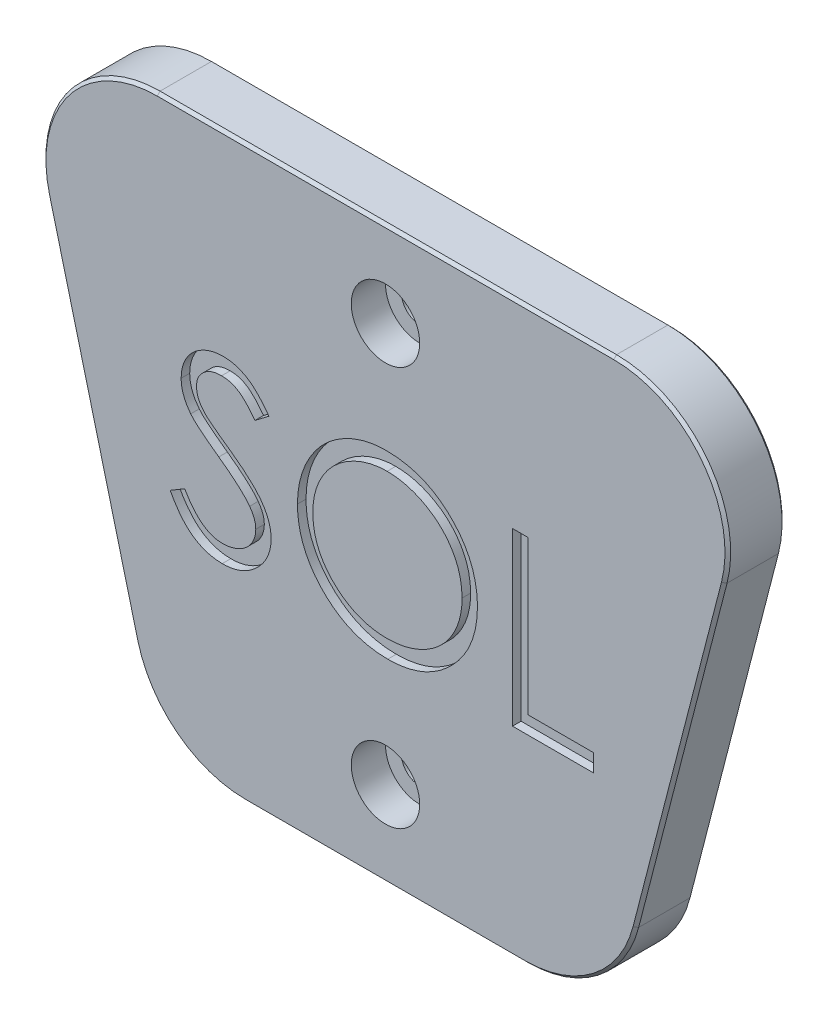
from build123d import *

# Parameters (mm, degrees)
BOSS_EXTRUDE1_DEPTH = 10
FILLET2_R           = 20
SKETCH10_R          = 6
CUT_EXTRUDE6_DEPTH  = 6
SKETCH11_R          = 3.2
CUT_EXTRUDE7_DEPTH  = 145.346804606
CUT_EXTRUDE8_DEPTH  = 1.5
CHAMFER1_SIZE       = 0.5


with BuildPart() as part:
    # Sketch2 → Boss-Extrude1 (new body)
    with BuildSketch(Plane.XY):
        with BuildLine():
            Line((0.635083269, -5), (20, -80))
            Line((20, -80), (100, -80))
            Line((100, -80), (119.364916731, -5))
            ThreePointArc((119.364916731, -5), (115.811388301, 12.247448714), (100, 20))
            Line((100, 20), (20, 20))
            ThreePointArc((20, 20), (4.188611699, 12.247448714), (0.635083269, -5))
        make_face()
    extrude(amount=BOSS_EXTRUDE1_DEPTH)

    # Fillet2
    fillet2_edges = [part.edges().sort_by_distance(p)[0] for p in [
        (20, -80, 5),
        (100, -80, 5),
    ]]
    fillet(fillet2_edges, radius=FILLET2_R)

    # Sketch10 → Cut-Extrude6 (cut)
    with BuildSketch(Plane.XY.offset(10)):
        with Locations((60, -65)):
            Circle(SKETCH10_R)
        with Locations((60, 5)):
            Circle(SKETCH10_R)
    extrude(amount=-CUT_EXTRUDE6_DEPTH, mode=Mode.SUBTRACT)

    # Sketch11 → Cut-Extrude7 (cut, through all)
    with BuildSketch(Plane.XY.offset(4)):
        with Locations((60, 5)):
            Circle(SKETCH11_R)
        with Locations((60, -65)):
            Circle(SKETCH11_R)
    extrude(amount=-CUT_EXTRUDE7_DEPTH, mode=Mode.SUBTRACT)

    # Sketch13 → Cut-Extrude8 (cut)
    # profile 1 of 3: a face of its own
    with BuildSketch(Plane.XY.offset(10)):
        with BuildLine():
            Line((22.269230769, -39.212740385), (24.805288462, -37.692307692))
            add(Edge.make_bspline(
                [(24.805288462, -37.692307692), (25.041159067, -38.087145278), (25.493078043, -38.843638854), (26.246946836, -39.865850629), (27.028086075, -40.734669116), (27.842280362, -41.445040037), (28.684559918, -42.004316209), (29.560423235, -42.400335338), (30.466918756, -42.647329413), (31.083837226, -42.677330155), (31.391826923, -42.692307692)],
                knots=[0, 0, 0, 0, 1.272034388, 2.437168799, 3.508375237, 4.49857839, 5.41946034, 6.295179144, 7.148887113, 8, 8, 8, 8], degree=3))
            add(Edge.make_bspline(
                [(31.391826923, -42.692307692), (31.654857156, -42.684981928), (32.176315211, -42.670458583), (32.943991579, -42.530908851), (33.689549884, -42.316519175), (34.397623922, -42.009482619), (35.058443475, -41.638009884), (35.637929435, -41.189328362), (36.138896119, -40.686989456), (36.54868853, -40.126566702), (36.863088832, -39.523848286), (37.104735133, -38.905197274), (37.238835764, -38.26089526), (37.259036508, -37.827091293), (37.269230769, -37.608173077)],
                knots=[0, 0, 0, 0, 1.095163259, 2.171163733, 3.241058638, 4.321873601, 5.38011039, 6.391990106, 7.366004449, 8.327778327, 9.272591725, 10.192022065, 11.087607919, 12, 12, 12, 12], degree=3))
            add(Edge.make_bspline(
                [(37.269230769, -37.608173077), (37.25659382, -37.358394365), (37.23090475, -36.850630744), (37.013777778, -36.101490861), (36.672212805, -35.360125975), (36.35710443, -34.901543699), (36.193509615, -34.663461538)],
                knots=[0, 0, 0, 0, 0.938893495, 1.908633276, 2.914225137, 4, 4, 4, 4], degree=3))
            add(Edge.make_bspline(
                [(36.193509615, -34.663461538), (36.059190065, -34.491631622), (35.777202971, -34.130896206), (35.292424292, -33.593937044), (34.723571884, -33.040064882), (34.090112842, -32.448130108), (33.36897208, -31.845663279), (32.582736242, -31.203935183), (31.711331737, -30.547350237), (31.100193194, -30.10701396), (30.784855769, -29.879807692)],
                knots=[0, 0, 0, 0, 0.722233717, 1.516239348, 2.393582979, 3.351407094, 4.387010283, 5.505090956, 6.712668013, 8, 8, 8, 8], degree=3))
            add(Edge.make_bspline(
                [(30.784855769, -29.879807692), (30.469221516, -29.654991227), (29.86575286, -29.225159265), (29.021822154, -28.58723683), (28.267155328, -28.004003663), (27.605106615, -27.469969274), (27.035967214, -26.985061233), (26.555252262, -26.55393604), (26.175207487, -26.16493409), (25.963873938, -25.912579732), (25.868990385, -25.799278846)],
                knots=[0, 0, 0, 0, 1.452282411, 2.77665338, 3.964542531, 5.026858415, 5.96415736, 6.766646006, 7.446254459, 8, 8, 8, 8], degree=3))
            add(Edge.make_bspline(
                [(25.868990385, -25.799278846), (25.736368568, -25.62269853), (25.475549968, -25.275429641), (25.131269921, -24.732645146), (24.838648526, -24.177017156), (24.609257107, -23.607052603), (24.416089517, -23.030753213), (24.286164397, -22.440599678), (24.204809566, -21.839240091), (24.196478253, -21.434552943), (24.192307692, -21.231971154)],
                knots=[0, 0, 0, 0, 1.068054152, 2.10047183, 3.106115577, 4.101338837, 5.06977816, 6.043150881, 7.020423561, 8, 8, 8, 8], degree=3))
            add(Edge.make_bspline(
                [(24.192307692, -21.231971154), (24.203495198, -20.914573086), (24.225631084, -20.286561111), (24.412835518, -19.369153993), (24.708317464, -18.493270417), (25.122273645, -17.667581842), (25.655908099, -16.91358772), (26.273445022, -16.222614975), (27.008972047, -15.641741413), (27.815994532, -15.134209484), (28.699334864, -14.736958696), (29.624971179, -14.437293152), (30.594374653, -14.267499515), (31.25097295, -14.243132958), (31.584134615, -14.230769231)],
                knots=[0, 0, 0, 0, 1.005424448, 1.989358655, 2.955360095, 3.929531133, 4.905563448, 5.876582895, 6.856512386, 7.866279853, 8.892233794, 9.918561126, 10.94386622, 12, 12, 12, 12], degree=3))
            add(Edge.make_bspline(
                [(31.584134615, -14.230769231), (31.937655475, -14.24296253), (32.640695633, -14.267211111), (33.674831766, -14.478047094), (34.67049505, -14.826909995), (35.47143732, -15.222812777), (36.098289561, -15.618224912), (36.576341555, -15.978394835), (37.060776848, -16.393038623), (37.555503032, -16.863260732), (38.052137256, -17.393375741), (38.558052561, -17.979753075), (39.074432008, -18.618809268), (39.406625094, -19.075019274), (39.576923077, -19.308894231)],
                knots=[0, 0, 0, 0, 1.286793592, 2.559021753, 3.825965368, 5.121522368, 5.803751409, 6.523245864, 7.299691795, 8.125521123, 9.008227632, 9.944561021, 10.946284179, 12, 12, 12, 12], degree=3))
            Line((39.576923077, -19.308894231), (37.143028846, -21.153846154))
            add(Edge.make_bspline(
                [(37.143028846, -21.153846154), (36.996063711, -20.964514522), (36.713043221, -20.599906065), (36.283361906, -20.089294789), (35.878373495, -19.622867821), (35.479370068, -19.217738153), (35.107424656, -18.851719867), (34.746421436, -18.538350523), (34.401555568, -18.274559705), (33.966839192, -17.993043476), (33.42068732, -17.713987732), (32.735105581, -17.477852777), (32.018651795, -17.335952246), (31.530683525, -17.317190353), (31.283653846, -17.307692308)],
                knots=[0, 0, 0, 0, 1.181633172, 2.275549214, 3.290209073, 4.226197932, 5.078386478, 5.862611352, 6.581680152, 7.217281963, 8.414376989, 9.595101626, 10.782541182, 12, 12, 12, 12], degree=3))
            add(Edge.make_bspline(
                [(31.283653846, -17.307692308), (30.973740797, -17.318078307), (30.376102676, -17.338106729), (29.527614938, -17.55684946), (28.763952723, -17.901265406), (28.10778788, -18.383965218), (27.561470934, -18.955859441), (27.166281287, -19.613963913), (26.928422734, -20.340670221), (26.89939748, -20.847598704), (26.884615385, -21.105769231)],
                knots=[0, 0, 0, 0, 1.14458467, 2.207223713, 3.21896685, 4.227309161, 5.202851033, 6.127160689, 7.046193047, 8, 8, 8, 8], degree=3))
            add(Edge.make_bspline(
                [(26.884615385, -21.105769231), (26.887985041, -21.26649619), (26.894729865, -21.588212928), (26.98879956, -22.06351083), (27.109650951, -22.537608025), (27.301159223, -23.008373021), (27.56554754, -23.484038956), (27.912734762, -23.972796706), (28.349991722, -24.478954209), (28.684937542, -24.80816027), (28.861778846, -24.981971154)],
                knots=[0, 0, 0, 0, 0.858281714, 1.717966888, 2.583508476, 3.4729293, 4.427298488, 5.488583878, 6.674047936, 8, 8, 8, 8], degree=3))
            add(Edge.make_bspline(
                [(28.861778846, -24.981971154), (28.927447753, -25.040574232), (29.083462042, -25.179801732), (29.368684263, -25.407735566), (29.745336819, -25.688902186), (30.203584258, -26.03679347), (30.75187593, -26.44034886), (31.390272125, -26.894408392), (32.111656692, -27.413712327), (32.623558829, -27.776776961), (32.894230769, -27.96875)],
                knots=[0, 0, 0, 0, 0.420754252, 0.999615792, 1.744751191, 2.668019286, 3.750313428, 4.999500688, 6.413464383, 8, 8, 8, 8], degree=3))
            add(Edge.make_bspline(
                [(32.894230769, -27.96875), (33.219824312, -28.205675939), (33.850291081, -28.664450183), (34.747356051, -29.35372744), (35.560731549, -30.027851171), (36.293273294, -30.682516374), (36.952218224, -31.312757171), (37.53025583, -31.92615586), (38.033275947, -32.518317912), (38.574812105, -33.277511417), (39.128164844, -34.209920711), (39.603377765, -35.352305613), (39.903020743, -36.499131217), (39.942205161, -37.269932673), (39.961538462, -37.650240385)],
                knots=[0, 0, 0, 0, 1.163667725, 2.253281268, 3.268753668, 4.215851969, 5.092017293, 5.902905408, 6.650798638, 7.335211899, 8.59617414, 9.77448103, 10.901945474, 12, 12, 12, 12], degree=3))
            add(Edge.make_bspline(
                [(39.961538462, -37.650240385), (39.955905849, -37.9191978), (39.944750006, -38.451889659), (39.816513602, -39.234076032), (39.628630758, -39.993769201), (39.345454467, -40.721578736), (38.999827396, -41.430819559), (38.561259557, -42.102887277), (38.052907973, -42.752656407), (37.469761417, -43.362800619), (36.831653683, -43.92291087), (36.157222014, -44.421159969), (35.445362532, -44.836602741), (34.699936961, -45.175609958), (33.920774074, -45.440754394), (33.108135927, -45.632864701), (32.260682974, -45.750770795), (31.684678846, -45.76300875), (31.391826923, -45.769230769)],
                knots=[0, 0, 0, 0, 0.983748083, 1.948392443, 2.894712957, 3.844097841, 4.80183111, 5.778335162, 6.776009319, 7.81870978, 8.863265674, 9.881300176, 10.883814829, 11.87499822, 12.874611388, 13.892143829, 14.928324115, 16, 16, 16, 16], degree=3))
            add(Edge.make_bspline(
                [(31.391826923, -45.769230769), (31.165238269, -45.764849213), (30.714914611, -45.756141281), (30.048833338, -45.679158877), (29.396208288, -45.570240846), (28.765228728, -45.397320247), (28.147765199, -45.187517586), (27.546503189, -44.929189021), (26.961151299, -44.619613009), (26.38842916, -44.265655655), (25.829793378, -43.85373213), (25.290483653, -43.373959303), (24.75280492, -42.83956926), (24.232627237, -42.236050146), (23.719428857, -41.573152293), (23.223328204, -40.844673578), (22.734056338, -40.054581974), (22.427066614, -39.498595525), (22.269230769, -39.212740385)],
                knots=[0, 0, 0, 0, 0.915332311, 1.819136955, 2.706846663, 3.586547465, 4.459518054, 5.340707479, 6.227863349, 7.133153174, 8.059268498, 9.028702269, 10.047606654, 11.120612155, 12.245963614, 13.433783089, 14.680604001, 16, 16, 16, 16], degree=3))
        make_face()
    # profile 2 of 3: a face of its own
    with BuildSketch(Plane.XY.offset(10)):
        with BuildLine():
            add(Edge.make_bspline(
                [(60.153846154, -14.230769231), (60.709344204, -14.244839054), (61.800388207, -14.272473347), (63.40388733, -14.484008521), (64.934702433, -14.849969006), (66.405303622, -15.337365999), (67.798100565, -15.987546445), (69.123576786, -16.773419145), (70.378578562, -17.703217363), (71.546190403, -18.769753593), (72.614678548, -19.930183198), (73.556043288, -21.168565284), (74.344977234, -22.477412161), (74.99285541, -23.85279071), (75.501129207, -25.291590435), (75.851863867, -26.801481887), (76.075905154, -28.372682088), (76.102097532, -29.444340928), (76.115384615, -29.987980769)],
                knots=[0, 0, 0, 0, 1.065120563, 2.091984664, 3.0946048, 4.079830382, 5.057816894, 6.036188127, 7.030412546, 8.04752943, 9.064399622, 10.05169764, 11.02544977, 11.989514704, 12.962713494, 13.945757189, 14.957906945, 16, 16, 16, 16], degree=3))
            add(Edge.make_bspline(
                [(76.115384615, -29.987980769), (76.102099479, -30.527616024), (76.075912937, -31.591299627), (75.85160913, -33.152529149), (75.49982913, -34.653306547), (74.99757542, -36.091126428), (74.352785605, -37.467505546), (73.558598424, -38.778822294), (72.623102332, -40.025506566), (71.55847218, -41.193900839), (70.39789182, -42.265307731), (69.153060961, -43.198898094), (67.851975362, -44.002247733), (66.477892149, -44.643250653), (65.049034691, -45.155581399), (63.552614778, -45.504889657), (61.995644315, -45.73020717), (60.933892854, -45.756080164), (60.394230769, -45.769230769)],
                knots=[0, 0, 0, 0, 1.043624062, 2.057103931, 3.04512605, 4.022047818, 4.998200453, 5.980619268, 6.982898556, 8.009068085, 9.034988726, 10.034168286, 11.015286542, 11.987931943, 12.962482838, 13.94673481, 14.956375938, 16, 16, 16, 16], degree=3))
            add(Edge.make_bspline(
                [(60.394230769, -45.769230769), (59.850593749, -45.75595031), (58.77894047, -45.729770991), (57.205765881, -45.50535895), (55.694813791, -45.154433489), (54.250405066, -44.652924035), (52.871734241, -44.004776344), (51.556104961, -43.214453094), (50.308797984, -42.276677599), (49.140154443, -41.212392674), (48.070875602, -40.053779371), (47.138652381, -38.812342899), (46.34815141, -37.512438984), (45.702179989, -36.150460206), (45.190770337, -34.732990697), (44.841871896, -33.250575176), (44.616135164, -31.711665126), (44.590122194, -30.663868855), (44.576923077, -30.132211538)],
                knots=[0, 0, 0, 0, 1.053102029, 2.075944431, 3.073151272, 4.055350789, 5.033113405, 6.020478099, 7.024410459, 8.052272461, 9.079885166, 10.07527673, 11.055994387, 12.023226415, 12.992069828, 13.970394897, 14.97016774, 16, 16, 16, 16], degree=3))
            add(Edge.make_bspline(
                [(44.576923077, -30.132211538), (44.581505667, -29.775360089), (44.590613036, -29.06615903), (44.700256114, -28.013016743), (44.85935641, -26.976811105), (45.087372803, -25.960488694), (45.385587092, -24.966537396), (45.737461612, -23.988102286), (46.167231715, -23.03509894), (46.653065841, -22.103012725), (47.19530991, -21.206373533), (47.794244905, -20.358834248), (48.428833778, -19.553282847), (49.124520009, -18.810594243), (49.858375254, -18.109162903), (50.642304209, -17.459768185), (51.471523446, -16.85655432), (52.349600987, -16.312951396), (53.254900486, -15.821301671), (54.18813001, -15.399400091), (55.136614909, -15.037290993), (56.104797605, -14.743798205), (57.09010708, -14.51209504), (58.094693805, -14.354317722), (59.117757459, -14.244394997), (59.806997336, -14.235330695), (60.153846154, -14.230769231)],
                knots=[0, 0, 0, 0, 1.037015668, 2.060948919, 3.074880161, 4.083647147, 5.086022904, 6.090072063, 7.104153813, 8.122640571, 9.144368836, 10.147691507, 11.138137339, 12.123020368, 13.103399296, 14.087645067, 15.080126199, 16.082011238, 17.087798457, 18.072939717, 19.057185487, 20.037253025, 21.01195951, 21.997135196, 22.992090687, 24, 24, 24, 24], degree=3))
        make_face()
        with BuildLine():
            add(Edge.make_bspline(
                [(60.286057692, -17.307692308), (60.001360833, -17.311162796), (59.434688837, -17.318070593), (58.592249955, -17.409062441), (57.760890522, -17.538747204), (56.940438846, -17.723731667), (56.134327794, -17.975766405), (55.335043441, -18.265831333), (54.549874408, -18.619154966), (53.781412769, -19.018349575), (53.036426411, -19.460197468), (52.333460399, -19.9485269), (51.670694879, -20.471885936), (51.049752593, -21.031495971), (50.472456832, -21.630206843), (49.927445105, -22.25894201), (49.436562977, -22.935672505), (48.986686604, -23.642047421), (48.584105116, -24.377146688), (48.226116361, -25.133231222), (47.933282, -25.916468537), (47.694461632, -26.718361316), (47.496463253, -27.537639542), (47.371029618, -28.380518246), (47.279037965, -29.242762064), (47.272525004, -29.82546367), (47.269230769, -30.120192308)],
                knots=[0, 0, 0, 0, 1.008559885, 2.007477868, 2.99961109, 3.989939068, 4.984837346, 5.991145699, 7.001802488, 8.033829008, 9.059044045, 10.069351652, 11.065060232, 12.050310815, 13.029377138, 14.011219647, 14.996725999, 15.989392538, 16.977580475, 17.965360261, 18.951710183, 19.937753436, 20.929683414, 21.935841486, 22.955955122, 24, 24, 24, 24], degree=3))
            add(Edge.make_bspline(
                [(47.269230769, -30.120192308), (47.280158157, -30.553582772), (47.301655711, -31.406195888), (47.489863454, -32.655637122), (47.779766093, -33.856393862), (48.207114948, -35.001895941), (48.741548788, -36.101989794), (49.401779276, -37.146916406), (50.184000009, -38.136958186), (51.072544523, -39.065203349), (52.043882008, -39.912453099), (53.075305407, -40.656139459), (54.1557649, -41.285370172), (55.288078066, -41.797985078), (56.466199829, -42.204182831), (57.697721695, -42.482571097), (58.97443992, -42.665789286), (59.844702679, -42.683384337), (60.286057692, -42.692307692)],
                knots=[0, 0, 0, 0, 1.032063989, 2.030389145, 3.003944642, 3.970395727, 4.937377036, 5.913328081, 6.909231446, 7.93887556, 8.970685674, 9.976071282, 10.964166581, 11.944589148, 12.933237628, 13.927779006, 14.949070134, 16, 16, 16, 16], degree=3))
            add(Edge.make_bspline(
                [(60.286057692, -42.692307692), (60.582710563, -42.688231941), (61.171062304, -42.680148501), (62.046166781, -42.598731271), (62.905505739, -42.46817239), (63.747873852, -42.280195342), (64.572315092, -42.044933573), (65.382270548, -41.765438762), (66.169113036, -41.41674273), (66.942768789, -41.031474574), (67.683308003, -40.592273223), (68.390241137, -40.120517655), (69.045749536, -39.597929477), (69.666227291, -39.046633941), (70.245893197, -38.455515245), (70.780827347, -37.825341915), (71.26922848, -37.152136282), (71.718934022, -36.446832804), (72.120104846, -35.709722067), (72.46963998, -34.950896256), (72.766178116, -34.17222389), (73.0055653, -33.372581848), (73.193154972, -32.553488859), (73.322411428, -31.713848189), (73.412826617, -30.855339539), (73.419641564, -30.274677917), (73.423076923, -29.981971154)],
                knots=[0, 0, 0, 0, 1.047197238, 2.076906641, 3.100256066, 4.114471768, 5.12198147, 6.126382909, 7.136867548, 8.15857795, 9.17633901, 10.174870724, 11.156907918, 12.133735059, 13.104061851, 14.077631395, 15.04955518, 16.038496417, 17.029181396, 18.010275684, 18.986308667, 19.968651475, 20.955262928, 21.950658345, 22.966943676, 24, 24, 24, 24], degree=3))
            add(Edge.make_bspline(
                [(73.423076923, -29.981971154), (73.419638812, -29.691266832), (73.412818685, -29.114601259), (73.322454617, -28.262079958), (73.193018413, -27.428481003), (73.006480916, -26.617076977), (72.766051027, -25.827661048), (72.469588195, -25.060974639), (72.119999914, -24.314161538), (71.718786562, -23.589067564), (71.267793789, -22.893284096), (70.774985989, -22.22812056), (70.231854434, -21.606068491), (69.653917078, -21.011771114), (69.026738061, -20.457903489), (68.353158397, -19.944281883), (67.641355445, -19.458510961), (66.887693427, -19.020291859), (66.109888109, -18.615598436), (65.31176847, -18.268875552), (64.502376187, -17.974257386), (63.68376951, -17.722969114), (62.849058267, -17.539471712), (62.003882591, -17.408945571), (61.149411803, -17.318102263), (60.574755634, -17.311173304), (60.286057692, -17.307692308)],
                knots=[0, 0, 0, 0, 1.02996197, 2.043119294, 3.035359645, 4.018872909, 4.991431989, 5.957985074, 6.929999688, 7.912076566, 8.892894881, 9.867085534, 10.843653904, 11.817741046, 12.803660682, 13.806313499, 14.818574707, 15.856120519, 16.894564902, 17.924820532, 18.937903209, 19.946497019, 20.957711757, 21.963978472, 22.977135795, 24, 24, 24, 24], degree=3))
        make_face(mode=Mode.SUBTRACT)
    # profile 3 of 3: a face of its own
    with BuildSketch(Plane.XY.offset(10)):
        Polygon((82.269230769, -15), (84.961538462, -15), (84.961538462, -41.923076923), (96.5, -41.923076923), (96.5, -45), (82.269230769, -45), align=None)
    extrude(amount=-CUT_EXTRUDE8_DEPTH, mode=Mode.SUBTRACT)

    # Chamfer1
    chamfer1_edges = [part.edges().sort_by_distance(p)[0] for p in [
        (115.811388301, 12.247448714, 0),
        (4.188611699, 12.247448714, 0),
        (8.381049961, -35, 0),
        (111.618950039, -35, 0),
        (56.8, -65, 0),
        (56.8, 5, 0),
        (4.188611699, 12.247448714, 10),
        (115.811388301, 12.247448714, 10),
        (111.618950039, -35, 10),
        (8.381049961, -35, 10),
        (60, -80, 0),
        (60, 20, 0),
        (60, 20, 10),
        (96.755515329, -75.811388301, 0),
        (23.244484671, -75.811388301, 0),
        (60, -80, 10),
        (23.244484671, -75.811388301, 10),
        (96.755515329, -75.811388301, 10),
    ]]
    chamfer(chamfer1_edges, length=CHAMFER1_SIZE)


solid = part.part
